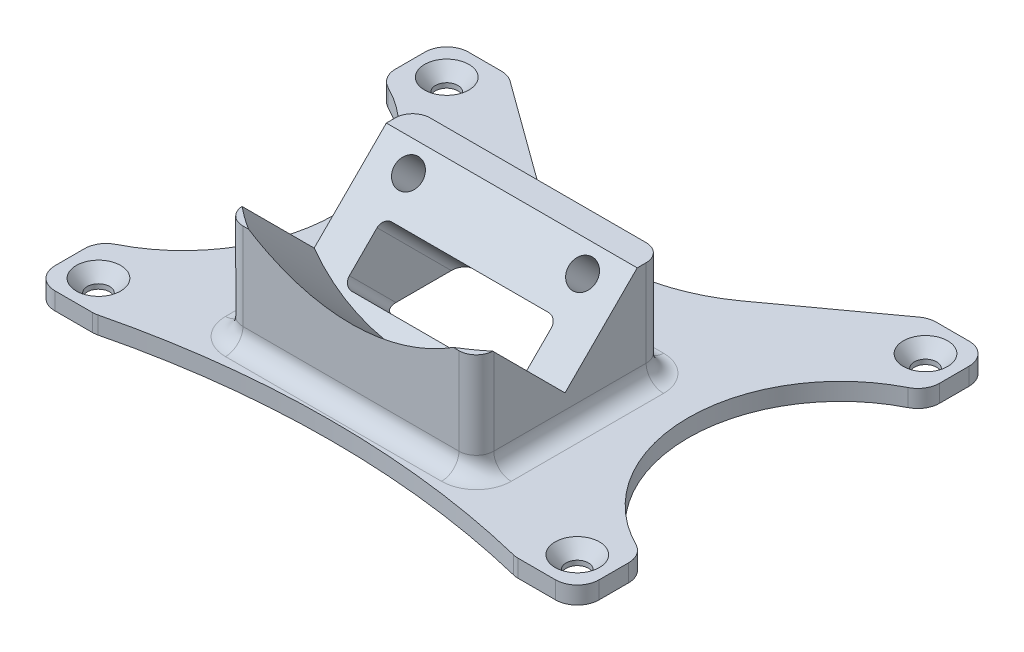
from build123d import *

# Parameters (mm, degrees)
BOSS_EXTRUDE1_DEPTH                           = 2.54
CSK_FOR_4_FLAT_HEAD_MACHINE_SCREW1_AT_2_COUNT = 2
CSK_FOR_4_FLAT_HEAD_MACHINE_SCREW1_AT_2_PITCH = 50.8
CSK_FOR_4_FLAT_HEAD_MACHINE_SCREW1_AT_3_COUNT = 2
CSK_FOR_4_FLAT_HEAD_MACHINE_SCREW1_AT_3_PITCH = 86.36933773
CSK_FOR_4_FLAT_HEAD_MACHINE_SCREW1_AT_4_COUNT = 2
CSK_FOR_4_FLAT_HEAD_MACHINE_SCREW1_AT_4_PITCH = 69.85
SKETCH5_W                                     = 36.59505
SKETCH5_H                                     = 27.305
BOSS_EXTRUDE2_DEPTH                           = 15.24
CUT_EXTRUDE2_REACH                            = 58.398
SKETCH8_R                                     = 2.0193
FILLET1_R                                     = 2.54
CUT_EXTRUDE4_DEPTH                            = 3.429
FILLET2_R                                     = 3.175
SKETCH10_W                                    = 25.4
SKETCH10_H                                    = 8.255
CUT_EXTRUDE5_DEPTH                            = 57.398148028
FILLET3_R                                     = 1.27


with BuildPart() as part:
    # Sketch1 → Boss-Extrude1 (new body)
    with BuildSketch(Plane(origin=(0, 0, 0), x_dir=(1, 0, 0), z_dir=(0, 1, 0))):
        with BuildLine():
            Line((-36.5125, 30.1625), (36.5125, 30.1625))
            ThreePointArc((36.5125, 30.1625), (38.75756403, 29.23256403), (39.6875, 26.9875))
            Line((39.6875, 26.9875), (39.6875, -26.9875))
            ThreePointArc((39.6875, -26.9875), (38.75756403, -29.23256403), (36.5125, -30.1625))
            Line((36.5125, -30.1625), (-36.5125, -30.1625))
            ThreePointArc((-36.5125, -30.1625), (-38.75756403, -29.23256403), (-39.6875, -26.9875))
            Line((-39.6875, -26.9875), (-39.6875, 26.9875))
            ThreePointArc((-39.6875, 26.9875), (-38.75756403, 29.23256403), (-36.5125, 30.1625))
        make_face()
    extrude(amount=BOSS_EXTRUDE1_DEPTH)

    # Sketch3 → CSK for #4 Flat Head Machine Screw1 (revolve, cut)
    with BuildSketch(Plane(origin=(-34.925, 2.54, -25.4), x_dir=(0, 0, 1), z_dir=(1, 0, 0))):
        Polygon((0, 0), (0, 2.54), (1.63195, 2.54), (1.63195, 1.848124365), (3.2385, 0), align=None)
    csk_for_4_flat_head_machine_screw1 = revolve(axis=Axis((-34.925, 8.89, -25.4), (0, -1, 0)), mode=Mode.SUBTRACT)

    # CSK for #4 Flat Head Machine Screw1 at 2: CSK for #4 Flat Head Machine Screw1 ×2
    with Locations(*[(0, 0, i * CSK_FOR_4_FLAT_HEAD_MACHINE_SCREW1_AT_2_PITCH) for i in range(1, CSK_FOR_4_FLAT_HEAD_MACHINE_SCREW1_AT_2_COUNT)]):
        add(csk_for_4_flat_head_machine_screw1, mode=Mode.SUBTRACT)

    # CSK for #4 Flat Head Machine Screw1 at 3: CSK for #4 Flat Head Machine Screw1 ×2
    with Locations(*[Vector(0.8087360843031886, 0, 0.5881716976750463) * (i * CSK_FOR_4_FLAT_HEAD_MACHINE_SCREW1_AT_3_PITCH) for i in range(1, CSK_FOR_4_FLAT_HEAD_MACHINE_SCREW1_AT_3_COUNT)]):
        add(csk_for_4_flat_head_machine_screw1, mode=Mode.SUBTRACT)

    # CSK for #4 Flat Head Machine Screw1 at 4: CSK for #4 Flat Head Machine Screw1 ×2
    with Locations(*[(i * CSK_FOR_4_FLAT_HEAD_MACHINE_SCREW1_AT_4_PITCH, 0, 0) for i in range(1, CSK_FOR_4_FLAT_HEAD_MACHINE_SCREW1_AT_4_COUNT)]):
        add(csk_for_4_flat_head_machine_screw1, mode=Mode.SUBTRACT)

    # Sketch5 → Boss-Extrude2 (add)
    with BuildSketch(Plane(origin=(0, 2.54, 0), x_dir=(1, 0, 0), z_dir=(0, 1, 0))):
        with Locations((0, -9.8425)):
            Rectangle(SKETCH5_W, SKETCH5_H)
    extrude(amount=BOSS_EXTRUDE2_DEPTH)

    # Sketch4 → Cut-Revolve1 (revolve, cut)
    with BuildSketch(Plane(origin=(0, 0, 0), x_dir=(0, 0, -1), z_dir=(1, 0, 0))):
        Polygon((-32.244261254, 22.052492284), (-6.188048119, 48.10870542), (12.054444166, 29.866213135), (-14.00176897, 3.81), align=None)
    revolve(axis=Axis((0, 29.866213135, -12.054444166), (0, 0.7071067811865511, 0.707106781186544)), mode=Mode.SUBTRACT)

    # Cut-Extrude2: up to this plane
    cut_extrude2_end = Plane(origin=(-18.297525, 17.78, -3.81), z_dir=(0, 0, 1))
    # Sketch8 → Cut-Extrude2 (cut, up to the surface)
    with BuildSketch(Plane(origin=(0, 8.905884485, 8.905884485), x_dir=(1, 0, 0), z_dir=(0, 0.7071067811865511, 0.707106781186544)), mode=Mode.PRIVATE) as cut_extrude2_sk1:
        with Locations(Location((-12.7, 9.195689, 0), (0, 0, 270))):
            Circle(SKETCH8_R)
    cut_extrude2_tool1 = split(extrude(cut_extrude2_sk1.sketch, amount=-CUT_EXTRUDE2_REACH, mode=Mode.PRIVATE), bisect_by=cut_extrude2_end, keep=Keep.BOTH, mode=Mode.PRIVATE)
    add(cut_extrude2_tool1.solids().sort_by_distance((-12.7, 15.408219, 2.40355))[0], mode=Mode.SUBTRACT)
    # Sketch8 → Cut-Extrude2 (cut, up to the surface)
    with BuildSketch(Plane(origin=(0, 8.905884485, 8.905884485), x_dir=(1, 0, 0), z_dir=(0, 0.7071067811865511, 0.707106781186544)), mode=Mode.PRIVATE) as cut_extrude2_sk2:
        with Locations(Location((12.7, 9.195689, 0), (0, 0, 270))):
            Circle(SKETCH8_R)
    cut_extrude2_tool2 = split(extrude(cut_extrude2_sk2.sketch, amount=-CUT_EXTRUDE2_REACH, mode=Mode.PRIVATE), bisect_by=cut_extrude2_end, keep=Keep.BOTH, mode=Mode.PRIVATE)
    add(cut_extrude2_tool2.solids().sort_by_distance((12.7, 15.408219, 2.40355))[0], mode=Mode.SUBTRACT)

    # Fillet1
    # the kernel refuses this fillet: 2.54 mm, written as the material it takes off along each edge
    with BuildSketch(Plane(origin=(18.297525, 2.54, -3.81), x_dir=(-1, 0, 0), z_dir=(0, 1, 0)), Plane(origin=(18.297525, 2.54, 23.495), x_dir=(0, 0, -1), z_dir=(0, 1, 0)), Plane(origin=(-18.297525, 2.54, 23.495), x_dir=(1, 0, 0), z_dir=(0, 1, 0))) as fillet1_piece_1:
        with BuildLine():
            CenterArc((FILLET1_R, FILLET1_R), FILLET1_R, 180, 90)
            Line((0, FILLET1_R), (0, 0))
            Line((0, 0), (FILLET1_R, 0))
        make_face()
    extrude(amount=21.59, mode=Mode.SUBTRACT)
    with BuildSketch(Plane(origin=(-18.297525, 2.54, -3.81), x_dir=(1, 0, 0), z_dir=(0, 1, 0))) as fillet1_piece_2:
        with BuildLine():
            CenterArc((FILLET1_R, -FILLET1_R), FILLET1_R, 90, 90)
            Line((0, -FILLET1_R), (0, 0))
            Line((0, 0), (FILLET1_R, 0))
        make_face()
    extrude(amount=21.59, mode=Mode.SUBTRACT)
    # the kernel refuses this fillet: 2.54 mm, written as the material it adds along each edge
    with BuildSketch(Plane(origin=(-15.757525, 2.54, -3.81), x_dir=(0, 0, -1), z_dir=(1, 0, 0)), Plane(origin=(15.757525, 2.54, 23.495), x_dir=(0, 0, 1), z_dir=(-1, 0, 0))) as fillet1_2_piece_1:
        with BuildLine():
            CenterArc((FILLET1_R, FILLET1_R), FILLET1_R, 180, 90)
            Line((0, FILLET1_R), (0, 0))
            Line((0, 0), (FILLET1_R, 0))
        make_face()
    extrude(amount=31.51505)
    with BuildSketch(Plane(origin=(18.297525, 2.54, -1.27), x_dir=(1, 0, 0), z_dir=(0, 0, 1)), Plane(origin=(-18.297525, 2.54, 20.955), x_dir=(-1, 0, 0), z_dir=(0, 0, -1))) as fillet1_2_piece_2:
        with BuildLine():
            CenterArc((FILLET1_R, FILLET1_R), FILLET1_R, 180, 90)
            Line((0, FILLET1_R), (0, 0))
            Line((0, 0), (FILLET1_R, 0))
        make_face()
    extrude(amount=22.225)
    with BuildSketch(Plane(origin=(-15.757525, 2.54, 20.955), x_dir=(0, 0, 1), z_dir=(1, 0, 0))) as fillet1_2_piece_3:
        with BuildLine():
            CenterArc((2.54 + FILLET1_R, -FILLET1_R), FILLET1_R, 90, 90)
            Line((2.54, -FILLET1_R), (2.54, 0))
            Line((2.54, 0), (2.54 + FILLET1_R, 0))
        make_face()
    revolve(axis=Axis((-15.757525, 2.54, 20.955), (0, -1, 0)), revolution_arc=90)
    with BuildSketch(Plane(origin=(-15.757525, 2.54, -1.27), x_dir=(0, 0, -1), z_dir=(1, 0, 0))) as fillet1_2_piece_4:
        with BuildLine():
            CenterArc((2.54 + FILLET1_R, FILLET1_R), FILLET1_R, 180, 90)
            Line((2.54, FILLET1_R), (2.54, 0))
            Line((2.54, 0), (2.54 + FILLET1_R, 0))
        make_face()
    revolve(axis=Axis((-15.757525, 2.54, -1.27), (0, 1, 0)), revolution_arc=90)
    with BuildSketch(Plane(origin=(15.757525, 2.54, 20.955), x_dir=(1, 0, 0), z_dir=(0, 0, -1))) as fillet1_2_piece_5:
        with BuildLine():
            CenterArc((2.54 + FILLET1_R, -FILLET1_R), FILLET1_R, 90, 90)
            Line((2.54, -FILLET1_R), (2.54, 0))
            Line((2.54, 0), (2.54 + FILLET1_R, 0))
        make_face()
    revolve(axis=Axis((15.757525, 2.54, 20.955), (0, -1, 0)), revolution_arc=90)
    with BuildSketch(Plane(origin=(15.757525, 2.54, -1.27), x_dir=(0, 0, -1), z_dir=(-1, 0, 0))) as fillet1_2_piece_6:
        with BuildLine():
            CenterArc((2.54 + FILLET1_R, -FILLET1_R), FILLET1_R, 90, 90)
            Line((2.54, -FILLET1_R), (2.54, 0))
            Line((2.54, 0), (2.54 + FILLET1_R, 0))
        make_face()
    revolve(axis=Axis((15.757525, 2.54, -1.27), (0, -1, 0)), revolution_arc=90)

    # Sketch9 → Cut-Extrude4 (cut)
    with BuildSketch(Plane(origin=(0, 2.54, 0), x_dir=(1, 0, 0), z_dir=(0, 1, 0))):
        with BuildLine():
            Line((-30.677270284, 30.1625), (30.677270284, 30.1625))
            Line((30.677270284, 30.1625), (14.939561121, 18.716893336))
            ThreePointArc((14.939561121, 18.716893336), (0, 13.858789877), (-14.939561121, 18.716893336))
            Line((-14.939561121, 18.716893336), (-30.677270284, 30.1625))
        make_face()
        with BuildLine():
            Line((-39.6875, 20.6375), (-39.6875, -20.6375))
            ThreePointArc((-39.6875, -20.6375), (-25.711391971, 0), (-39.6875, 20.6375))
        make_face()
        with BuildLine():
            Line((39.6875, 20.6375), (39.6875, -20.6375))
            ThreePointArc((39.6875, -20.6375), (25.711391971, 0), (39.6875, 20.6375))
        make_face()
        with BuildLine():
            Line((-30.677270284, -30.1625), (30.677270284, -30.1625))
            ThreePointArc((30.677270284, -30.1625), (0, -26.401718952), (-30.677270284, -30.1625))
        make_face()
    extrude(amount=-CUT_EXTRUDE4_DEPTH, mode=Mode.SUBTRACT)

    # Fillet2
    fillet2_edges = [part.edges().sort_by_distance(p)[0] for p in [
        (-39.6875, 1.27, -20.6375),
        (-39.6875, 1.27, 20.6375),
        (-30.677270284, 1.27, 30.1625),
        (30.677270284, 1.27, 30.1625),
        (39.6875, 1.27, 20.6375),
        (39.6875, 1.27, -20.6375),
        (30.677270284, 1.27, -30.1625),
        (-30.677270284, 1.27, -30.1625),
    ]]
    fillet(fillet2_edges, radius=FILLET2_R)

    # Sketch10 → Cut-Extrude5 (cut, through all)
    with BuildSketch(Plane(origin=(0, 8.905884485, 8.905884485), x_dir=(1, 0, 0), z_dir=(0, 0.7071067811865529, 0.7071067811865422))):
        with Locations((0, -0.1378966)):
            Rectangle(SKETCH10_W, SKETCH10_H)
    extrude(amount=-CUT_EXTRUDE5_DEPTH, mode=Mode.SUBTRACT)

    # Fillet3
    fillet3_edges = [part.edges().sort_by_distance(p)[0] for p in [
        (12.7, 5.863480052, 0.221328815),
        (12.7, 2.944896812, 8.977078533),
        (-12.7, 2.944896812, 8.977078533),
        (-12.7, 5.863480052, 0.221328815),
    ]]
    fillet(fillet3_edges, radius=FILLET3_R)


solid = part.part
